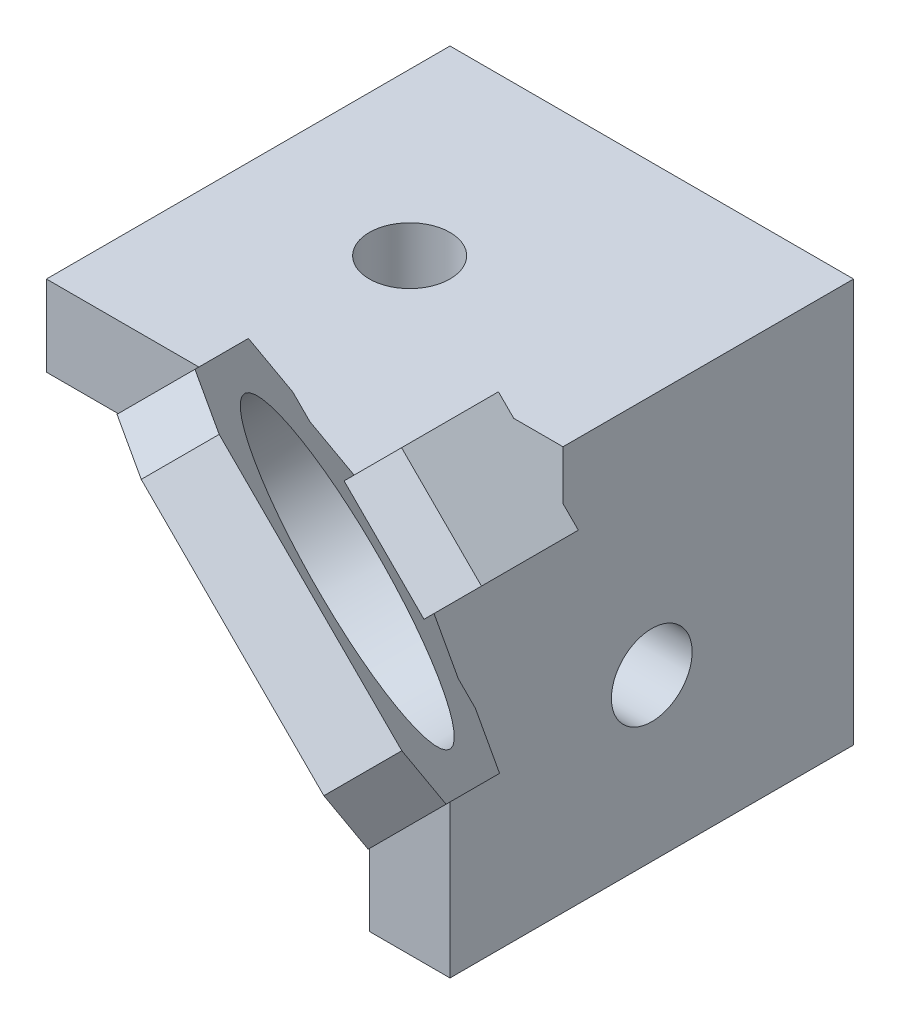
from build123d import *

# Parameters (mm, degrees)
SKETCH_7_W           = 25
SKETCH_7_H           = 25
EXTRUDE_4_DEPTH      = 25
SKETCH_8_W           = 20
SKETCH_8_H           = 20
CUT_EXTRUDE_1_DEPTH  = 25
EXTRUDE_5_DEPTH      = 10
EXTRUDE_5_DEPTH_BACK = 3
CUT_EXTRUDE_2_DEPTH  = 10
EXTRUDE_6_DEPTH      = 22
CUT_EXTRUDE_3_DEPTH  = 68.266533187
CUT_EXTRUDE_4_DEPTH  = 67.673882167
CHAMFER_1_SIZE       = 4
CHAMFER_1_SIZE_2     = 5.616920973
CHAMFER_2_SIZE       = 3
SKETCH_19_R          = 2.5
CUT_EXTRUDE_5_DEPTH  = 62.956153018
SKETCH_20_R          = 2.5
CUT_EXTRUDE_6_DEPTH  = 62.956153018


with BuildPart() as part:
    # 草图7 → 凸台-拉伸4 (new body)
    with BuildSketch(Plane.XY):
        Rectangle(SKETCH_7_W, SKETCH_7_H)
    extrude(amount=EXTRUDE_4_DEPTH)

    # 草图8 → 切除-拉伸1 (cut)
    with BuildSketch(Plane.XY.offset(25)):
        with Locations((-2.5, -2.5)):
            Rectangle(SKETCH_8_W, SKETCH_8_H)
    extrude(amount=-CUT_EXTRUDE_1_DEPTH, mode=Mode.SUBTRACT)

    # 草图10 → 凸台-拉伸5 (add, two sides: drawn at the far end of the back side and taken through both)
    with BuildSketch(Plane.XY.offset(25).offset(-EXTRUDE_5_DEPTH_BACK)):
        Polygon((7.550252532, 12.5), (12.5, 7.550252532), (17.449747468, 12.5), (12.5, 17.449747468), align=None)
    extrude(amount=EXTRUDE_5_DEPTH + EXTRUDE_5_DEPTH_BACK)

    # 草图12 → 切除-拉伸2 (cut)
    with BuildSketch(Plane(origin=(2.474873734, -2.474873734, 0), x_dir=(0, 0, -1), z_dir=(0.7071067811865479, -0.7071067811865472, 0))):
        Polygon((-35, 21.17766953), (-35, 14.17766953), (-28, 21.17766953), align=None)
    extrude(amount=-CUT_EXTRUDE_2_DEPTH, mode=Mode.SUBTRACT)

    # 草图14 → 凸台-拉伸6 (add)
    with BuildSketch(Plane(origin=(17.386931804, 17.386931804, 24.588834765), x_dir=(0.8660254037844374, -0.2886751345948163, -0.4082482904638636), z_dir=(0.5000000000000024, 0.5000000000000028, 0.707106781186544))):
        Polygon((-9.655381356, -7.592593438), (-7.34598028, -4.326607114), (-13.469704637, 0.003519905), (-14.624405175, -1.629473257), (-15.779105713, -3.262466419), align=None)
        Polygon((-6.797643323, -9.61331938), (-4.488242246, -6.347333056), (-7.34598028, -4.326607114), (-9.655381356, -7.592593438), align=None)
        Polygon((-1.630504213, -8.368058998), (-4.488242246, -6.347333056), (-6.797643323, -9.61331938), (-3.93990529, -11.634045322), (-3.745735964, -11.359448428), (-1.748641805, -8.535130783), align=None)
        Polygon((4.493220144, -12.698186017), (-1.630504213, -8.368058998), (-1.748641805, -8.535130783), (-3.745735964, -11.359448428), (-3.93990529, -11.634045322), (2.183819067, -15.964172341), (3.338519605, -14.331179179), align=None)
    extrude(amount=EXTRUDE_6_DEPTH)

    # 草图15 → 切除-拉伸3 (cut, through all)
    with BuildSketch(Plane(origin=(-5.886931804, -5.886931804, 8.325378798), x_dir=(0.8660254037844424, -0.28867513459480876, 0.4082482904638581), z_dir=(-0.49999999999999367, -0.5000000000000014, 0.7071067811865511))):
        with BuildLine():
            ThreePointArc((35.427552476, 37.374203131), (32.228532553, 44.255237221), (24.905634667, 46.244590168))
            Line((24.905634667, 46.244590168), (27.949470284, 28.503816094))
            ThreePointArc((27.949470284, 28.503816094), (33.308586565, 31.573223054), (35.427552476, 37.374203131))
        make_face()
        with BuildLine():
            Line((27.949470284, 28.503816094), (24.905634667, 46.244590168))
            ThreePointArc((24.905634667, 46.244590168), (17.557165439, 35.852285323), (27.949470284, 28.503816094))
        make_face()
    extrude(amount=-CUT_EXTRUDE_3_DEPTH, mode=Mode.SUBTRACT)

    # 草图17 → 切除-拉伸4 (cut, through all)
    with BuildSketch(Plane(origin=(2.474873734, -2.474873734, 0), x_dir=(0, 0, -1), z_dir=(0.7071067811865479, -0.7071067811865472, 0))):
        Polygon((-32.914213562, 16.263455967), (-25, 14.17766953), (-35, 14.17766953), align=None)
    extrude(amount=-CUT_EXTRUDE_4_DEPTH, mode=Mode.SUBTRACT)

    # 倒角1
    # the kernel refuses this chamfer: 5.616920973, 4 mm, written as the material it adds along each edge
    with BuildSketch(Plane(origin=(-2.724247244, 22.774499775, 25), x_dir=(-0.7071067811865471, -0.707106781186548, 0), z_dir=(0.707106781186548, -0.7071067811865471, 0))) as chamfer_1_piece_1_section:
        Polygon((CHAMFER_1_SIZE, 0), (-CHAMFER_1_SIZE_2 * 0.254847364233, -CHAMFER_1_SIZE_2 * 0.966981292987), (0, 0), align=None)
    chamfer_1_piece_1 = extrude(amount=36.060673858, mode=Mode.PRIVATE)
    chamfer_1_piece_1 = split(chamfer_1_piece_1, bisect_by=Plane(origin=(12.5, 22.774499775, 25), z_dir=(-1, 0, 0)), keep=Keep.TOP, mode=Mode.PRIVATE)
    chamfer_1_piece_1 = split(chamfer_1_piece_1, bisect_by=Plane(origin=(-2.724247244, 12.5, 25), z_dir=(0, -1, 0)), keep=Keep.TOP, mode=Mode.PRIVATE)
    chamfer_1_piece_1 = split(chamfer_1_piece_1, bisect_by=Plane(origin=(-2.724247244, 7.5, 25), z_dir=(0, 1, 0)), keep=Keep.TOP, mode=Mode.PRIVATE)
    add(chamfer_1_piece_1)
    with BuildSketch(Plane(origin=(7.550252532, 12.5, 25), x_dir=(-0.7071067811865471, -0.707106781186548, 0), z_dir=(0.707106781186548, -0.7071067811865471, 0))) as chamfer_1_piece_2_section:
        Polygon((CHAMFER_1_SIZE, 0), (-CHAMFER_1_SIZE_2 * 0.254847364233, -CHAMFER_1_SIZE_2 * 0.966981292987), (0, 0), align=None)
    chamfer_1_piece_2 = extrude(amount=7, mode=Mode.PRIVATE)
    chamfer_1_piece_2 = split(chamfer_1_piece_2, bisect_by=Plane(origin=(7.5, 12.5, 25), z_dir=(1, 0, 0)), keep=Keep.TOP, mode=Mode.PRIVATE)
    add(chamfer_1_piece_2)
    with BuildSketch(Plane(origin=(-2.724247244, 22.774499775, 25), x_dir=(-0.7071067811865471, -0.707106781186548, 0), z_dir=(0.707106781186548, -0.7071067811865471, 0))) as chamfer_1_piece_3_section:
        Polygon((CHAMFER_1_SIZE, 0), (-CHAMFER_1_SIZE_2 * 0.254847364233, -CHAMFER_1_SIZE_2 * 0.966981292987), (0, 0), align=None)
    chamfer_1_piece_3 = extrude(amount=36.060673858, mode=Mode.PRIVATE)
    chamfer_1_piece_3 = split(chamfer_1_piece_3, bisect_by=Plane(origin=(12.5, 22.774499775, 25), z_dir=(-1, 0, 0)), keep=Keep.TOP, mode=Mode.PRIVATE)
    chamfer_1_piece_3 = split(chamfer_1_piece_3, bisect_by=Plane(origin=(12.5, 7.550252532, 25), z_dir=(0.7071067811865479, -0.7071067811865472, 0)), keep=Keep.TOP, mode=Mode.PRIVATE)
    add(chamfer_1_piece_3)
    with BuildSketch(Plane(origin=(-2.73647942, 12.5, 22), x_dir=(0, 0, -1), z_dir=(1, 0, 0))) as chamfer_1_piece_4_section:
        Polygon((CHAMFER_1_SIZE, 0), (0, CHAMFER_1_SIZE), (0, 0), align=None)
    chamfer_1_piece_4 = extrude(amount=15.23647942, mode=Mode.PRIVATE)
    chamfer_1_piece_4 = split(chamfer_1_piece_4, bisect_by=Plane(origin=(2.406886556, 7.356634024, 22), z_dir=(0.7071067811865481, -0.7071067811865469, 0)), keep=Keep.TOP, mode=Mode.PRIVATE)
    add(chamfer_1_piece_4)
    with BuildSketch(Plane(origin=(12.5, 12.5, 22), x_dir=(0, 0, -1), z_dir=(0, -1, 0))) as chamfer_1_piece_5_section:
        Polygon((CHAMFER_1_SIZE, 0), (0, CHAMFER_1_SIZE), (0, 0), align=None)
    chamfer_1_piece_5 = extrude(amount=15.23647942, mode=Mode.PRIVATE)
    chamfer_1_piece_5 = split(chamfer_1_piece_5, bisect_by=Plane(origin=(14.974873734, 10.025126266, 22), z_dir=(-0.7071067811865479, 0.7071067811865472, 0)), keep=Keep.TOP, mode=Mode.PRIVATE)
    add(chamfer_1_piece_5)
    with BuildSketch(Plane(origin=(12.5, 22.786731952, 22), x_dir=(0, 0, -1), z_dir=(0, -1, 0))) as chamfer_1_piece_6a_section:
        Polygon((CHAMFER_1_SIZE, 0), (0, CHAMFER_1_SIZE), (0, 0), align=None)
    chamfer_1_piece_6a = extrude(amount=25.523211372, mode=Mode.PRIVATE)
    chamfer_1_piece_6a = split(chamfer_1_piece_6a, bisect_by=Plane(origin=(12.5, 12.5, 22), z_dir=(0, 1, 0)), keep=Keep.TOP, mode=Mode.PRIVATE)
    chamfer_1_piece_6a = split(chamfer_1_piece_6a, bisect_by=Plane(origin=(9.831507758, 20.11823971, 22), z_dir=(-0.7071067811865471, -0.7071067811865479, 0)), keep=Keep.TOP, mode=Mode.PRIVATE)
    with BuildSketch(Plane(origin=(-2.73647942, 12.5, 22), x_dir=(0, 0, -1), z_dir=(1, 0, 0))) as chamfer_1_piece_6b_section:
        Polygon((CHAMFER_1_SIZE, 0), (0, CHAMFER_1_SIZE), (0, 0), align=None)
    chamfer_1_piece_6b = extrude(amount=25.523211372, mode=Mode.PRIVATE)
    chamfer_1_piece_6b = split(chamfer_1_piece_6b, bisect_by=Plane(origin=(12.5, 12.5, 22), z_dir=(1, 0, 0)), keep=Keep.TOP, mode=Mode.PRIVATE)
    chamfer_1_piece_6b = split(chamfer_1_piece_6b, bisect_by=Plane(origin=(7.356634024, 22.593113444, 22), z_dir=(-0.7071067811865471, -0.7071067811865479, 0)), keep=Keep.TOP, mode=Mode.PRIVATE)
    chamfer_1_piece_6 = chamfer_1_piece_6a & chamfer_1_piece_6b
    add(chamfer_1_piece_6)

    # 倒角2
    # the kernel refuses this chamfer: 3 mm, written as the material it adds along each edge
    with BuildSketch(Plane(origin=(10.117349252, 5.167601784, 38.369577002), x_dir=(-0.4999999999999727, -0.5000000000000319, -0.7071067811865441), z_dir=(0.4999999999999975, 0.49999999999999795, -0.7071067811865509))) as chamfer_2_piece_1_section:
        Polygon((CHAMFER_2_SIZE, 0), (0, -CHAMFER_2_SIZE), (0, 0), align=None)
    chamfer_2_piece_1 = extrude(amount=11.715048964, mode=Mode.PRIVATE)
    chamfer_2_piece_1 = split(chamfer_2_piece_1, bisect_by=Plane(origin=(14.674958319, 9.725210851, 36.670886955), z_dir=(0.6837590295367584, 0.6837590295367588, -0.2548473642278849)), keep=Keep.TOP, mode=Mode.PRIVATE)
    add(chamfer_2_piece_1)
    with BuildSketch(Plane(origin=(10.117349252, 5.167601784, 38.369577002), x_dir=(-0.4999999999999727, -0.5000000000000319, -0.7071067811865441), z_dir=(0.4999999999999975, 0.49999999999999795, -0.7071067811865509))) as chamfer_2_piece_2_section:
        Polygon((CHAMFER_2_SIZE, 0), (0, -CHAMFER_2_SIZE), (0, 0), align=None)
    chamfer_2_piece_2 = extrude(amount=19.430097928, mode=Mode.PRIVATE)
    chamfer_2_piece_2 = split(chamfer_2_piece_2, bisect_by=Plane(origin=(14.674958319, 9.725210851, 36.670886955), z_dir=(-0.6837590295367584, -0.6837590295367588, 0.2548473642278849)), keep=Keep.TOP, mode=Mode.PRIVATE)
    chamfer_2_piece_2 = split(chamfer_2_piece_2, bisect_by=Plane(origin=(14.621320344, 9.671572875, 32), z_dir=(0.5000000000001488, 0.5000000000001488, -0.7071067811863374)), keep=Keep.TOP, mode=Mode.PRIVATE)
    add(chamfer_2_piece_2)
    with BuildSketch(Plane(origin=(5.167601784, 10.117349252, 38.369577002), x_dir=(-0.5000000000000279, -0.4999999999999769, -0.7071067811865442), z_dir=(0.4999999999999972, 0.4999999999999981, -0.7071067811865508))) as chamfer_2_piece_3_section:
        Polygon((CHAMFER_2_SIZE, 0), (0, CHAMFER_2_SIZE), (0, 0), align=None)
    chamfer_2_piece_3 = extrude(amount=11.715048964, mode=Mode.PRIVATE)
    chamfer_2_piece_3 = split(chamfer_2_piece_3, bisect_by=Plane(origin=(9.725210851, 14.674958319, 36.670886955), z_dir=(0.6837590295367584, 0.6837590295367588, -0.2548473642278849)), keep=Keep.TOP, mode=Mode.PRIVATE)
    add(chamfer_2_piece_3)
    with BuildSketch(Plane(origin=(5.167601784, 10.117349252, 38.369577002), x_dir=(-0.5000000000000279, -0.4999999999999769, -0.7071067811865442), z_dir=(0.4999999999999972, 0.4999999999999981, -0.7071067811865508))) as chamfer_2_piece_4_section:
        Polygon((CHAMFER_2_SIZE, 0), (0, CHAMFER_2_SIZE), (0, 0), align=None)
    chamfer_2_piece_4 = extrude(amount=19.430097928, mode=Mode.PRIVATE)
    chamfer_2_piece_4 = split(chamfer_2_piece_4, bisect_by=Plane(origin=(9.725210851, 14.674958319, 36.670886955), z_dir=(-0.6837590295367584, -0.6837590295367588, 0.2548473642278849)), keep=Keep.TOP, mode=Mode.PRIVATE)
    chamfer_2_piece_4 = split(chamfer_2_piece_4, bisect_by=Plane(origin=(9.671572875, 14.621320344, 32), z_dir=(0.5000000000001488, 0.5000000000001488, -0.7071067811863374)), keep=Keep.TOP, mode=Mode.PRIVATE)
    add(chamfer_2_piece_4)
    # the kernel refuses this chamfer: 3 mm, written as the material it takes off along each edge
    with BuildSketch(Plane(origin=(9.579349889, 25.135699075, 24.630422998), x_dir=(0.5000000000000019, 0.500000000000003, 0.7071067811865441), z_dir=(-0.4999999999999936, -0.5000000000000017, 0.707106781186551)), Plane(origin=(36.135699075, 20.579349889, 40.186772184), x_dir=(-0.5000000000000017, -0.5000000000000041, -0.7071067811865435), z_dir=(-0.49999999999999606, -0.4999999999999983, 0.7071067811865517))) as chamfer_2_2_piece_1:
        Polygon((CHAMFER_2_SIZE, 0), (0, -CHAMFER_2_SIZE), (0, 0), align=None)
    extrude(amount=19.430097928, mode=Mode.SUBTRACT)
    with BuildSketch(Plane(origin=(10.864300925, 26.420650111, 53.925926188), x_dir=(0.7071067811865505, -0.7071067811865446, -3.2729791283493846e-15), z_dir=(0.4999999999999941, 0.5000000000000017, -0.7071067811865506)), Plane(origin=(15.420650111, -0.135699075, 38.369577002), x_dir=(-0.7071067811865483, 0.7071067811865468, 1.224326607529039e-15), z_dir=(0.49999999999999667, 0.4999999999999989, -0.7071067811865507))) as chamfer_2_2_piece_2:
        Polygon((CHAMFER_2_SIZE, 0), (0, CHAMFER_2_SIZE), (0, 0), align=None)
    extrude(amount=19.430097928, mode=Mode.SUBTRACT)

    # 草图19 → 切除-拉伸5 (cut, through all)
    with BuildSketch(Plane.XZ.offset(-7.5)):
        with Locations(Location((-2.5, 12.5, 0), (0, 0, 270))):
            Circle(SKETCH_19_R)
    extrude(amount=-CUT_EXTRUDE_5_DEPTH, mode=Mode.SUBTRACT)

    # 草图20 → 切除-拉伸6 (cut, through all)
    with BuildSketch(Plane.ZY.offset(-7.5)):
        with Locations((12.5, -2.5)):
            Circle(SKETCH_20_R)
    extrude(amount=-CUT_EXTRUDE_6_DEPTH, mode=Mode.SUBTRACT)


solid = part.part
